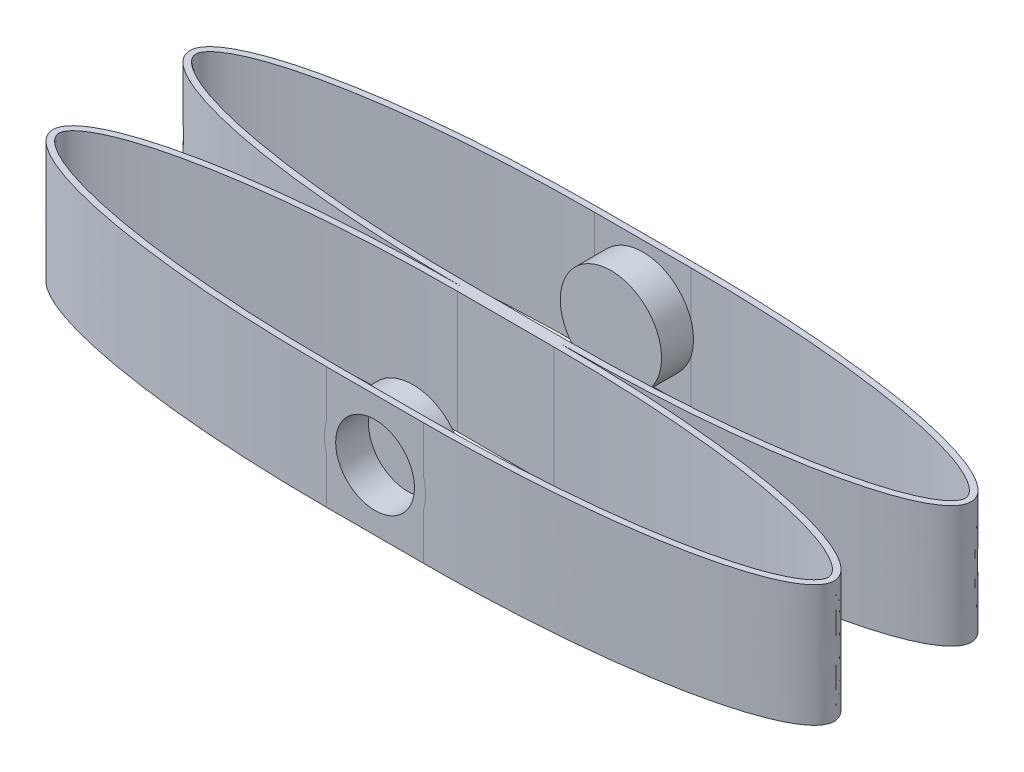
from build123d import *

# Parameters (mm, degrees)
EXTRUDE_THIN1_START = -8
EXTRUDE_THIN1_DEPTH = 16
SKETCH2_R           = 6.65
BOSS_EXTRUDE1_DEPTH = 5
SKETCH5_R           = 5.175
CUT_EXTRUDE1_DEPTH  = 4.318


# Read off the part's stored shape, not the designer's step: Extrude-Thin1
with BuildPart() as part:
    # Extrude-Thin1 outline → Extrude-Thin1 (new body)
    with BuildSketch(Plane(origin=(0, 0, 0), x_dir=(1, 0, 0), z_dir=(0, 1, 0)).offset(EXTRUDE_THIN1_START)):
        with BuildLine():
            Line((6.35, 9), (-6.35, 9))
            add(Edge.make_bspline(
                [(-6.35, 9), (-51.35, 9), (-51.35, 0), (-51.35, -9), (-6.35, -9)],
                knots=[4.71238898, 4.71238898, 4.71238898, 6.283185307, 6.283185307, 7.853981634, 7.853981634, 7.853981634], degree=2, weights=[1, 0.707106781, 1, 0.707106781, 1]))
            Line((-6.35, -9), (6.35, -9))
            add(Edge.make_bspline(
                [(6.35, -9), (51.35, -9), (51.35, 0), (51.35, 9), (6.35, 9)],
                knots=[4.71238898, 4.71238898, 4.71238898, 6.283185307, 6.283185307, 7.853981634, 7.853981634, 7.853981634], degree=2, weights=[1, 0.707106781, 1, 0.707106781, 1]))
        make_face()
        with BuildLine():
            add(Edge.make_bspline(
                [(-6.35, 8.2), (-10.174380765, 8.2), (-13.988093175, 8.103867577), (-21.592314649, 7.702517688), (-25.383030607, 7.399164531), (-31.045299991, 6.72963227), (-32.928707007, 6.470265723), (-36.684519657, 5.852399293), (-38.557092614, 5.495407177), (-41.352554092, 4.839190159), (-42.282113048, 4.600072481), (-44.134501836, 4.061201065), (-45.059898059, 3.76119124), (-46.412407935, 3.242628867), (-46.858015127, 3.058001434), (-47.733929315, 2.654300393), (-48.164477904, 2.435770697), (-48.999709559, 1.940478836), (-49.407859851, 1.664056253), (-49.948053299, 1.170940461), (-50.118212883, 0.991254685), (-50.399547739, 0.590043306), (-50.512974037, 0.366922361), (-50.557469482, -0.001202798), (-50.549174268, -0.124544172), (-50.491622584, -0.364574759), (-50.444631645, -0.477440548), (-50.269212651, -0.80251764), (-50.113345589, -0.992100075), (-49.771193493, -1.342236759), (-49.584320363, -1.5010423), (-49.199093823, -1.794683184), (-48.999193943, -1.93043343), (-48.384821647, -2.31539271), (-47.954372095, -2.543406427), (-47.078590663, -2.961942836), (-46.634577991, -3.151424757), (-45.290574888, -3.681199134), (-44.378825058, -3.983484977), (-42.537613063, -4.530810056), (-41.607827684, -4.774804655), (-39.735682227, -5.222152185), (-38.792068078, -5.425467309), (-36.901682063, -5.799592513), (-35.955098585, -5.970335741), (-33.112031287, -6.443636749), (-31.212274514, -6.707781236), (-25.50351894, -7.388890167), (-21.685187672, -7.6963233), (-14.030776797, -8.102884617), (-10.19452569, -8.2), (-6.35, -8.2)],
                knots=[0, 0, 0, 0, 0.125, 0.125, 0.25, 0.25, 0.3125, 0.3125, 0.375, 0.375, 0.40625, 0.40625, 0.4375, 0.4375, 0.453125, 0.453125, 0.46875, 0.46875, 0.484375, 0.484375, 0.4921875, 0.4921875, 0.5, 0.5, 0.50390625, 0.50390625, 0.5078125, 0.5078125, 0.515625, 0.515625, 0.5234375, 0.5234375, 0.53125, 0.53125, 0.546875, 0.546875, 0.5625, 0.5625, 0.59375, 0.59375, 0.625, 0.625, 0.65625, 0.65625, 0.6875, 0.6875, 0.75, 0.75, 0.875, 0.875, 1, 1, 1, 1], degree=3))
            Line((-6.35, 8.2), (6.35, 8.2))
            add(Edge.make_bspline(
                [(6.35, -8.2), (10.174380765, -8.2), (13.988093175, -8.103867577), (21.592314649, -7.702517688), (25.383030607, -7.399164531), (31.045299991, -6.72963227), (32.928707007, -6.470265723), (36.684519657, -5.852399293), (38.557092614, -5.495407177), (41.352554092, -4.839190159), (42.282113048, -4.600072481), (44.134501836, -4.061201065), (45.059898059, -3.76119124), (46.412407935, -3.242628867), (46.858015127, -3.058001434), (47.733929315, -2.654300393), (48.164477904, -2.435770697), (48.999709559, -1.940478836), (49.407859851, -1.664056253), (49.948053299, -1.170940461), (50.118212883, -0.991254685), (50.399547739, -0.590043306), (50.512974037, -0.366922361), (50.557469482, 0.001202798), (50.549174268, 0.124544172), (50.491622584, 0.364574759), (50.444631645, 0.477440548), (50.269212651, 0.80251764), (50.113345589, 0.992100075), (49.771193493, 1.342236759), (49.584320363, 1.5010423), (49.199093823, 1.794683184), (48.999193943, 1.93043343), (48.384821647, 2.31539271), (47.954372095, 2.543406427), (47.078590663, 2.961942836), (46.634577991, 3.151424757), (45.290574888, 3.681199134), (44.378825058, 3.983484977), (42.537613063, 4.530810056), (41.607827684, 4.774804655), (39.735682227, 5.222152185), (38.792068078, 5.425467309), (36.901682063, 5.799592513), (35.955098585, 5.970335741), (33.112031287, 6.443636749), (31.212274514, 6.707781236), (25.50351894, 7.388890167), (21.685187672, 7.6963233), (14.030776797, 8.102884617), (10.19452569, 8.2), (6.35, 8.2)],
                knots=[0, 0, 0, 0, 0.125, 0.125, 0.25, 0.25, 0.3125, 0.3125, 0.375, 0.375, 0.40625, 0.40625, 0.4375, 0.4375, 0.453125, 0.453125, 0.46875, 0.46875, 0.484375, 0.484375, 0.4921875, 0.4921875, 0.5, 0.5, 0.50390625, 0.50390625, 0.5078125, 0.5078125, 0.515625, 0.515625, 0.5234375, 0.5234375, 0.53125, 0.53125, 0.546875, 0.546875, 0.5625, 0.5625, 0.59375, 0.59375, 0.625, 0.625, 0.65625, 0.65625, 0.6875, 0.6875, 0.75, 0.75, 0.875, 0.875, 1, 1, 1, 1], degree=3))
            Line((6.35, -8.2), (-6.35, -8.2))
        make_face(mode=Mode.SUBTRACT)
    extrude_thin1 = extrude(amount=EXTRUDE_THIN1_DEPTH)

    # Sketch2 → Boss-Extrude1 (add)
    with BuildSketch(Plane(origin=(0, 0, -9), x_dir=(-1, 0, 0), z_dir=(0, 0, -1))):
        Circle(SKETCH2_R)
    boss_extrude1 = extrude(amount=-BOSS_EXTRUDE1_DEPTH)

    # Sketch5 → Cut-Extrude1 (cut)
    with BuildSketch(Plane(origin=(0, 0, -9), x_dir=(-1, 0, 0), z_dir=(0, 0, -1))):
        Circle(SKETCH5_R)
    cut_extrude1 = extrude(amount=-CUT_EXTRUDE1_DEPTH, mode=Mode.SUBTRACT)

    # Mirror3: Extrude-Thin1, Boss-Extrude1, Cut-Extrude1 across plane
    add(extrude_thin1.mirror(Plane(origin=(-6.35, 8, 9), x_dir=(1, 0, 0), z_dir=(0, 0, -1))))
    add(boss_extrude1.mirror(Plane(origin=(-6.35, 8, 9), x_dir=(1, 0, 0), z_dir=(0, 0, -1))))
    add(cut_extrude1.mirror(Plane(origin=(-6.35, 8, 9), x_dir=(1, 0, 0), z_dir=(0, 0, -1))), mode=Mode.SUBTRACT)


solid = part.part
